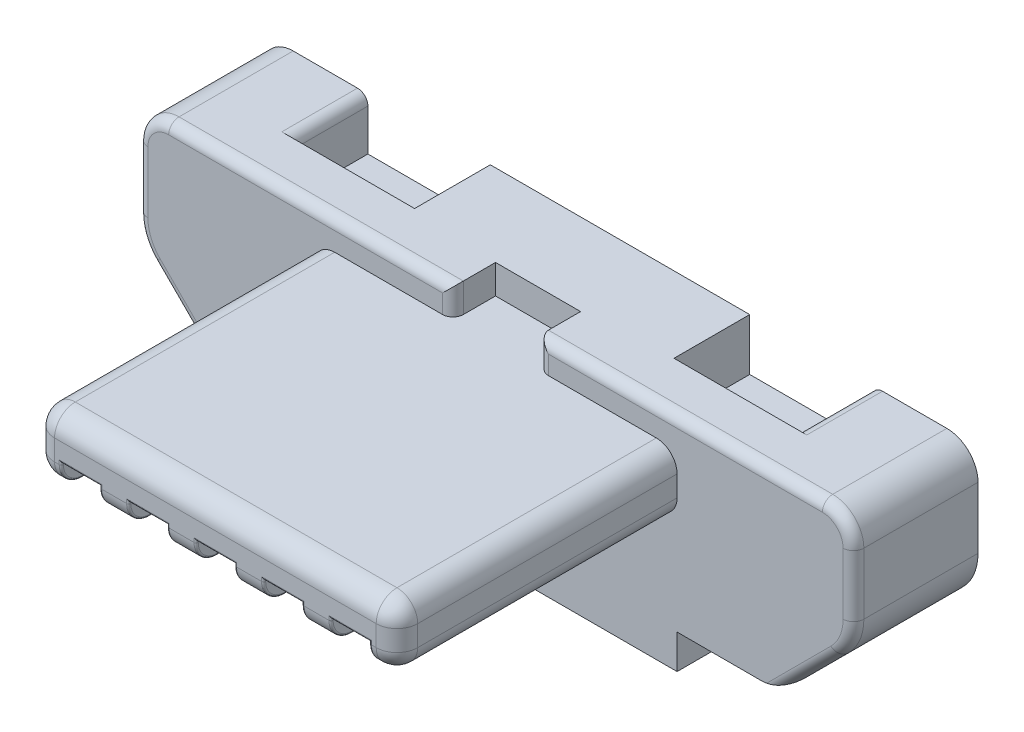
from build123d import *

# Parameters (mm, degrees)
BOSS_EXTRUDE1_DEPTH = 1.2
FILLET1_R           = 0.3
SKETCH4_W           = 1.18
SKETCH4_H           = 2.066052664
CUT_EXTRUDE2_DEPTH  = 0.5
SKETCH5_W           = 3.5
SKETCH5_H           = 0.4
BOSS_EXTRUDE3_DEPTH = 0.28
CUT_EXTRUDE3_DEPTH  = 2.28
CUT_EXTRUDE4_DEPTH  = 2.28
SKETCH2_W           = 0.82
SKETCH2_H           = 0.82
CUT_EXTRUDE1_DEPTH  = 0.41
SKETCH3_W           = 3.5
SKETCH3_H           = 0.6
BOSS_EXTRUDE2_DEPTH = 2.7
FILLET5_R           = 0.2
FILLET7_R           = 0.5
FILLET8_R           = 0.1
FILLET9_R           = 0.1
SKETCH9_W           = 3.5
SKETCH9_H           = 0.6
BOSS_EXTRUDE4_DEPTH = 0.16
SKETCH10_W          = 0.37
SKETCH10_H          = 0.37
CUT_EXTRUDE5_DEPTH  = 2.7
SKETCH13_W          = 0.25
SKETCH13_H          = 0.15
SKETCH11_W          = 0.37
SKETCH11_H          = 0.15
CUT_EXTRUDE6_DEPTH  = 2.8
SKETCH14_W          = 0.25
SKETCH14_H          = 0.15
SKETCH16_W          = 0.25
SKETCH16_H          = 0.15
CUT_EXTRUDE7_DEPTH  = 0.16
SKETCH17_W          = 0.37
SKETCH17_H          = 0.15
BOSS_EXTRUDE5_DEPTH = 2.8
SKETCH18_W          = 0.37
SKETCH18_H          = 0.15
CUT_EXTRUDE8_DEPTH  = 0.15
FILLET10_R          = 0.1
SKETCH19_W          = 0.37
SKETCH19_H          = 0.15
BOSS_EXTRUDE6_DEPTH = 0.15
FILLET11_R          = 0.15
FILLET12_R          = 0.15
FILLET13_R          = 0.15
FILLET14_R          = 0.15
FILLET15_R          = 0.15
FILLET16_R          = 0.01
FILLET17_R          = 0.01
FILLET18_R          = 0.01
FILLET19_R          = 0.01
FILLET20_R          = 0.01
FILLET21_R          = 0.01
FILLET22_R          = 0.01
FILLET23_R          = 0.01
FILLET24_R          = 0.01
FILLET25_R          = 0.01
FILLET26_R          = 0.02


with BuildPart() as part:
    # Sketch1 → Boss-Extrude1 (new body)
    with BuildSketch(Plane.XY):
        Polygon((3.45, 0.925), (-3.45, 0.925), (-3.45, -0.175), (-2.7, -0.925), (2.7, -0.925), (3.45, -0.175), align=None)
    extrude(amount=BOSS_EXTRUDE1_DEPTH)

    # Fillet1
    fillet1_edges = [part.edges().sort_by_distance(p)[0] for p in [
        (-3.45, 0.925, 0.6),
        (3.45, 0.925, 0.6),
    ]]
    fillet(fillet1_edges, radius=FILLET1_R)

    # Sketch4 → Cut-Extrude2 (cut)
    with BuildSketch(Plane(origin=(0, 0.925, 0), x_dir=(1, 0, 0), z_dir=(0, 1, 0))):
        with Locations((-1.84, 0.303026332)):
            Rectangle(SKETCH4_W, SKETCH4_H)
        with Locations((1.84, 0.303026332)):
            Rectangle(SKETCH4_W, SKETCH4_H)
    extrude(amount=-CUT_EXTRUDE2_DEPTH, mode=Mode.SUBTRACT)

    # Sketch5 → Boss-Extrude3 (add)
    with BuildSketch(Plane.XZ.offset(0.925)):
        with Locations((0, 1)):
            Rectangle(SKETCH5_W, SKETCH5_H)
    extrude(amount=BOSS_EXTRUDE3_DEPTH)

    # Sketch7 → Cut-Extrude3 (cut)
    with BuildSketch(Plane.ZY.offset(1.75)):
        Polygon((0, -0.925), (1.2, -0.875), (1.2, -0.925), align=None)
    extrude(amount=CUT_EXTRUDE3_DEPTH, mode=Mode.SUBTRACT)

    # Sketch8 → Cut-Extrude4 (cut)
    with BuildSketch(Plane(origin=(1.75, 0, 0), x_dir=(0, 0, -1), z_dir=(1, 0, 0))):
        Polygon((0, -0.925), (-1.2, -0.875), (-1.2, -0.925), align=None)
    extrude(amount=CUT_EXTRUDE4_DEPTH, mode=Mode.SUBTRACT)

    # Sketch2 → Cut-Extrude1 (cut)
    with BuildSketch(Plane.XY.offset(1.2)):
        with Locations((0, 1.055)):
            Rectangle(SKETCH2_W, SKETCH2_H)
    extrude(amount=-CUT_EXTRUDE1_DEPTH, mode=Mode.SUBTRACT)

    # Sketch3 → Boss-Extrude2 (add)
    with BuildSketch(Plane.XY.offset(1.2)):
        with Locations((0, 0.345)):
            Rectangle(SKETCH3_W, SKETCH3_H)
    extrude(amount=BOSS_EXTRUDE2_DEPTH)

    # Fillet5
    fillet5_edges = [part.edges().sort_by_distance(p)[0] for p in [
        (0, 0.045, 3.9),
        (-1.75, 0.345, 3.9),
        (0, 0.645, 3.9),
        (1.75, 0.345, 3.9),
        (-1.75, 0.045, 2.55),
        (-1.75, 0.645, 2.55),
        (1.75, 0.045, 2.55),
        (1.75, 0.645, 2.55),
    ]]
    fillet(fillet5_edges, radius=FILLET5_R)

    # Fillet7
    fillet7_edges = [part.edges().sort_by_distance(p)[0] for p in [
        (2.725, -0.9, 0.6),
        (3.45, -0.175, 0.6),
        (-3.45, -0.175, 0.6),
        (-2.725, -0.9, 0.6),
    ]]
    fillet(fillet7_edges, radius=FILLET7_R)

    # Fillet8
    # the kernel refuses this fillet: 0.1 mm, written as the material it takes off along each edge
    with BuildSketch(Plane(origin=(-3.45, 0.625, 1.2), x_dir=(1, 0, 0), z_dir=(0, -1, 0)), Plane(origin=(3.45, 0.032106781, 1.2), x_dir=(-1, 0, 0), z_dir=(0, 1, 0))) as fillet8_piece_1:
        with BuildLine():
            CenterArc((FILLET8_R, -FILLET8_R), FILLET8_R, 90, 90)
            Line((0, -FILLET8_R), (-FILLET8_R * 0.02, -FILLET8_R))
            Line((-FILLET8_R * 0.02, -FILLET8_R), (-FILLET8_R * 0.02, FILLET8_R * 0.02))
            Line((-FILLET8_R * 0.02, FILLET8_R * 0.02), (FILLET8_R, FILLET8_R * 0.02))
            Line((FILLET8_R, FILLET8_R * 0.02), (FILLET8_R, 0))
        make_face()
    extrude(amount=0.592893219, mode=Mode.SUBTRACT)
    with BuildSketch(Plane(origin=(3.15, 0.625, 1.2), x_dir=(0, 1, 0), z_dir=(-1, 0, 0))) as fillet8_piece_2:
        with BuildLine():
            CenterArc((0.3 - FILLET8_R, FILLET8_R), FILLET8_R, 270, 90)
            Line((0.3, FILLET8_R), (0.3 + FILLET8_R * 0.02, FILLET8_R))
            Line((0.3 + FILLET8_R * 0.02, FILLET8_R), (0.3 + FILLET8_R * 0.02, -FILLET8_R * 0.02))
            Line((0.3 + FILLET8_R * 0.02, -FILLET8_R * 0.02), (0.3 - FILLET8_R, -FILLET8_R * 0.02))
            Line((0.3 - FILLET8_R, -FILLET8_R * 0.02), (0.3 - FILLET8_R, 0))
        make_face()
    revolve(axis=Axis((3.15, 0.625, 1.2), (0, 0, -1)), revolution_arc=90, mode=Mode.SUBTRACT)
    with BuildSketch(Plane(origin=(-3.15, 0.625, 1.2), x_dir=(0, 1, 0), z_dir=(1, 0, 0))) as fillet8_piece_3:
        with BuildLine():
            CenterArc((0.3 - FILLET8_R, -FILLET8_R), FILLET8_R, 0, 90)
            Line((0.3, -FILLET8_R), (0.3 + FILLET8_R * 0.02, -FILLET8_R))
            Line((0.3 + FILLET8_R * 0.02, -FILLET8_R), (0.3 + FILLET8_R * 0.02, FILLET8_R * 0.02))
            Line((0.3 + FILLET8_R * 0.02, FILLET8_R * 0.02), (0.3 - FILLET8_R, FILLET8_R * 0.02))
            Line((0.3 - FILLET8_R, FILLET8_R * 0.02), (0.3 - FILLET8_R, 0))
        make_face()
    revolve(axis=Axis((-3.15, 0.625, 1.2), (0, 0, 1)), revolution_arc=90, mode=Mode.SUBTRACT)
    with BuildSketch(Plane(origin=(0.41, 1.525, 1.2), x_dir=(1, 0, 0), z_dir=(0, -1, 0)), Plane(origin=(-0.41, 0.645, 1.2), x_dir=(-1, 0, 0), z_dir=(0, 1, 0))) as fillet8_piece_4:
        with BuildLine():
            CenterArc((FILLET8_R, -FILLET8_R), FILLET8_R, 90, 90)
            Line((0, -FILLET8_R), (-FILLET8_R * 0.02, -FILLET8_R))
            Line((-FILLET8_R * 0.02, -FILLET8_R), (-FILLET8_R * 0.02, FILLET8_R * 0.02))
            Line((-FILLET8_R * 0.02, FILLET8_R * 0.02), (FILLET8_R, FILLET8_R * 0.02))
            Line((FILLET8_R, FILLET8_R * 0.02), (FILLET8_R, 0))
        make_face()
    extrude(amount=0.88, mode=Mode.SUBTRACT)
    with BuildSketch(Plane(origin=(0.19, 0.925, 1.2), x_dir=(0, -1, 0), z_dir=(-1, 0, 0)), Plane(origin=(3.15, 0.925, 1.2), x_dir=(0, -1, 0), z_dir=(-1, 0, 0))) as fillet8_piece_5:
        with BuildLine():
            CenterArc((FILLET8_R, -FILLET8_R), FILLET8_R, 90, 90)
            Line((0, -FILLET8_R), (-FILLET8_R * 0.02, -FILLET8_R))
            Line((-FILLET8_R * 0.02, -FILLET8_R), (-FILLET8_R * 0.02, FILLET8_R * 0.02))
            Line((-FILLET8_R * 0.02, FILLET8_R * 0.02), (FILLET8_R, FILLET8_R * 0.02))
            Line((FILLET8_R, FILLET8_R * 0.02), (FILLET8_R, 0))
        make_face()
    extrude(amount=3.34, mode=Mode.SUBTRACT)
    with BuildSketch(Plane(origin=(2.47261638, -1.15238362, 1.2), x_dir=(-0.7071067811865477, 0.7071067811865474, 0), z_dir=(0.7071067811865475, 0.7071067811865477, 0)), Plane(origin=(-3.303553391, -0.321446609, 1.2), x_dir=(0.7071067811865476, 0.7071067811865476, 0), z_dir=(0.7071067811865477, -0.7071067811865476, 0))) as fillet8_piece_6:
        with BuildLine():
            CenterArc((FILLET8_R, -FILLET8_R), FILLET8_R, 90, 90)
            Line((0, -FILLET8_R), (-FILLET8_R * 0.02, -FILLET8_R))
            Line((-FILLET8_R * 0.02, -FILLET8_R), (-FILLET8_R * 0.02, FILLET8_R * 0.02))
            Line((-FILLET8_R * 0.02, FILLET8_R * 0.02), (FILLET8_R, FILLET8_R * 0.02))
            Line((FILLET8_R, FILLET8_R * 0.02), (FILLET8_R, 0))
        make_face()
    extrude(amount=1.175122389, mode=Mode.SUBTRACT)
    with BuildSketch(Plane(origin=(2.95, 0.032106781, 1.2), x_dir=(0.7071067811865479, -0.7071067811865474, 0), z_dir=(-0.7071067811865474, -0.7071067811865479, 0))) as fillet8_piece_7:
        with BuildLine():
            CenterArc((0.5 - FILLET8_R, -FILLET8_R), FILLET8_R, 0, 90)
            Line((0.5, -FILLET8_R), (0.5 + FILLET8_R * 0.02, -FILLET8_R))
            Line((0.5 + FILLET8_R * 0.02, -FILLET8_R), (0.5 + FILLET8_R * 0.02, FILLET8_R * 0.02))
            Line((0.5 + FILLET8_R * 0.02, FILLET8_R * 0.02), (0.5 - FILLET8_R, FILLET8_R * 0.02))
            Line((0.5 - FILLET8_R, FILLET8_R * 0.02), (0.5 - FILLET8_R, 0))
        make_face()
    revolve(axis=Axis((2.95, 0.032106781, 1.2), (0, 0, 1)), revolution_arc=45, mode=Mode.SUBTRACT)
    with BuildSketch(Plane(origin=(-2.95, 0.032106781, 1.2), x_dir=(-1, 0, 0), z_dir=(0, 1, 0))) as fillet8_piece_8:
        with BuildLine():
            CenterArc((0.5 - FILLET8_R, -FILLET8_R), FILLET8_R, 0, 90)
            Line((0.5, -FILLET8_R), (0.5 + FILLET8_R * 0.02, -FILLET8_R))
            Line((0.5 + FILLET8_R * 0.02, -FILLET8_R), (0.5 + FILLET8_R * 0.02, FILLET8_R * 0.02))
            Line((0.5 + FILLET8_R * 0.02, FILLET8_R * 0.02), (0.5 - FILLET8_R, FILLET8_R * 0.02))
            Line((0.5 - FILLET8_R, FILLET8_R * 0.02), (0.5 - FILLET8_R, 0))
        make_face()
    revolve(axis=Axis((-2.95, 0.032106781, 1.2), (0, 0, 1)), revolution_arc=45, mode=Mode.SUBTRACT)

    # Fillet9
    fillet9_edges = [part.edges().sort_by_distance(p)[0] for p in [
        (-2.43, 0.925, 0.365),
        (2.43, 0.925, 0.365),
    ]]
    fillet(fillet9_edges, radius=FILLET9_R)

    # Sketch9 → Boss-Extrude4 (add)
    with BuildSketch(Plane.XZ.offset(0.925)):
        with Locations((0, 0.35)):
            Rectangle(SKETCH9_W, SKETCH9_H)
    extrude(amount=BOSS_EXTRUDE4_DEPTH)

    # Sketch10 → Cut-Extrude5 (cut)
    with BuildSketch(Plane.XY.offset(3.9)):
        with Locations((-1.3, 0.08)):
            Rectangle(SKETCH10_W, SKETCH10_H)
        with Locations((-0.65, 0.08)):
            Rectangle(SKETCH10_W, SKETCH10_H)
        with Locations((0, 0.08)):
            Rectangle(SKETCH10_W, SKETCH10_H)
        with Locations((0.65, 0.08)):
            Rectangle(SKETCH10_W, SKETCH10_H)
        with Locations((1.3, 0.08)):
            Rectangle(SKETCH10_W, SKETCH10_H)
    extrude(amount=-CUT_EXTRUDE5_DEPTH, mode=Mode.SUBTRACT)

    # Cut-Sweep2: sweep along a path in Sketch12
    with BuildLine(Plane(origin=(0, 0, 0), x_dir=(0, 0, -1), z_dir=(1, 0, 0))) as cut_sweep2_path:
        Line((-3.7, 0.315), (-0.55, 0.315))
        ThreePointArc((-0.55, 0.315), (-0.408578644, 0.256421356), (-0.35, 0.115))
        Line((-0.35, 0.115), (-0.35, -1.085))
    # Sketch13 → Cut-Sweep2 (sweep, cut)
    with BuildSketch(Plane.XY.offset(3.7)):
        with Locations((-1.3, 0.24)):
            Rectangle(SKETCH13_W, SKETCH13_H)
        with Locations((-0.65, 0.24)):
            Rectangle(SKETCH13_W, SKETCH13_H)
        with Locations((0, 0.24)):
            Rectangle(SKETCH13_W, SKETCH13_H)
        with Locations((0.65, 0.24)):
            Rectangle(SKETCH13_W, SKETCH13_H)
        with Locations((1.3, 0.24)):
            Rectangle(SKETCH13_W, SKETCH13_H)
    sweep(path=cut_sweep2_path.line, mode=Mode.SUBTRACT)

    # Sketch11 → Cut-Extrude6 (cut)
    with BuildSketch(Plane.XY.offset(3.7)):
        with Locations((-1.3, 0.24)):
            Rectangle(SKETCH11_W, SKETCH11_H)
        with Locations((-0.65, 0.24)):
            Rectangle(SKETCH11_W, SKETCH11_H)
        with Locations((0, 0.24)):
            Rectangle(SKETCH11_W, SKETCH11_H)
        with Locations((0.65, 0.24)):
            Rectangle(SKETCH11_W, SKETCH11_H)
        with Locations((1.3, 0.24)):
            Rectangle(SKETCH11_W, SKETCH11_H)
    extrude(amount=-CUT_EXTRUDE6_DEPTH, mode=Mode.SUBTRACT)

    # Sketch16 → Cut-Extrude7 (cut)
    with BuildSketch(Plane.XZ.offset(1.085)):
        with Locations((-1.3, 0.575)):
            Rectangle(SKETCH16_W, SKETCH16_H)
        with Locations((-0.65, 0.575)):
            Rectangle(SKETCH16_W, SKETCH16_H)
        with Locations((0, 0.575)):
            Rectangle(SKETCH16_W, SKETCH16_H)
        with Locations((0.65, 0.575)):
            Rectangle(SKETCH16_W, SKETCH16_H)
        with Locations((1.3, 0.575)):
            Rectangle(SKETCH16_W, SKETCH16_H)
    extrude(amount=-CUT_EXTRUDE7_DEPTH, mode=Mode.SUBTRACT)

    # Sketch18 → Cut-Extrude8 (cut)
    with BuildSketch(Plane.XZ.offset(-0.315)):
        with Locations((1.3, 3.625)):
            Rectangle(SKETCH18_W, SKETCH18_H)
        with Locations((0.65, 3.625)):
            Rectangle(SKETCH18_W, SKETCH18_H)
        with Locations((0, 3.625)):
            Rectangle(SKETCH18_W, SKETCH18_H)
        with Locations((-0.65, 3.625)):
            Rectangle(SKETCH18_W, SKETCH18_H)
        with Locations((-1.3, 3.625)):
            Rectangle(SKETCH18_W, SKETCH18_H)
    extrude(amount=-CUT_EXTRUDE8_DEPTH, mode=Mode.SUBTRACT)

    # Fillet10
    fillet10_edges = [part.edges().sort_by_distance(p)[0] for p in [
        (-1.3, -1.085, 0.35),
        (-0.65, -1.085, 0.35),
        (0, -1.085, 0.35),
        (0.65, -1.085, 0.35),
        (1.3, -1.085, 0.35),
        (1.3, 0.315, 3.55),
        (0.65, 0.315, 3.55),
        (0, 0.315, 3.55),
        (-0.65, 0.315, 3.55),
        (-1.3, 0.315, 3.55),
    ]]
    fillet(fillet10_edges, radius=FILLET10_R)

    # Fillet26
    fillet26_edges = [part.edges().sort_by_distance(p)[0] for p in [
        (-1.115, 0.103578644, 3.841421356),
        (-1.485, 0.103578644, 3.841421356),
        (-1.485, 0.045, 2.45),
        (-1.115, 0.045, 2.45),
        (-1.485, 0.255, 3.9),
        (-1.115, 0.255, 3.9),
        (-1.3, 0.265, 3.9),
        (-0.465, 0.103578644, 3.841421356),
        (-0.835, 0.103578644, 3.841421356),
        (-0.835, 0.045, 2.45),
        (-0.465, 0.045, 2.45),
        (-0.835, 0.255, 3.9),
        (-0.465, 0.255, 3.9),
        (-0.65, 0.265, 3.9),
        (0.185, 0.103578644, 3.841421356),
        (-0.185, 0.103578644, 3.841421356),
        (-0.185, 0.045, 2.45),
        (0.185, 0.045, 2.45),
        (-0.185, 0.255, 3.9),
        (0.185, 0.255, 3.9),
        (0, 0.265, 3.9),
        (0.835, 0.103578644, 3.841421356),
        (0.465, 0.103578644, 3.841421356),
        (0.465, 0.045, 2.45),
        (0.835, 0.045, 2.45),
        (0.465, 0.255, 3.9),
        (0.835, 0.255, 3.9),
        (0.65, 0.265, 3.9),
        (1.485, 0.103578644, 3.841421356),
        (1.115, 0.103578644, 3.841421356),
        (1.115, 0.045, 2.45),
        (1.485, 0.045, 2.45),
        (1.115, 0.255, 3.9),
        (1.485, 0.255, 3.9),
        (1.3, 0.265, 3.9),
    ]]
    fillet(fillet26_edges, radius=FILLET26_R)


with BuildPart() as body_2:
    # Sweep3: sweep along a path in Sketch15
    with BuildLine(Plane(origin=(0, 0, 0), x_dir=(0, 0, -1), z_dir=(1, 0, 0))) as sweep3_path:
        Line((0.3, -1.085), (-0.3, -1.085))
        ThreePointArc((-0.3, -1.085), (-0.335355339, -1.070355339), (-0.35, -1.035))
        Line((-0.35, -1.035), (-0.35, 0.115))
        ThreePointArc((-0.35, 0.115), (-0.408578644, 0.256421356), (-0.55, 0.315))
        Line((-0.55, 0.315), (-3.7, 0.315))
    # Sketch14 → Sweep3 (sweep)
    with BuildSketch(Plane.XY.offset(3.7)):
        with Locations((-1.3, 0.24)):
            Rectangle(SKETCH14_W, SKETCH14_H)
        with Locations((1.3, 0.24)):
            Rectangle(SKETCH14_W, SKETCH14_H)
        with Locations((0.65, 0.24)):
            Rectangle(SKETCH14_W, SKETCH14_H)
        with Locations((0, 0.24)):
            Rectangle(SKETCH14_W, SKETCH14_H)
        with Locations((-0.65, 0.24)):
            Rectangle(SKETCH14_W, SKETCH14_H)
    sweep(path=sweep3_path.line)

    # Sketch17 → Boss-Extrude5 (add)
    with BuildSketch(Plane.XY.offset(3.7)):
        with Locations((-0.65, 0.24)):
            Rectangle(SKETCH17_W, SKETCH17_H)
        with Locations((-1.3, 0.24)):
            Rectangle(SKETCH17_W, SKETCH17_H)
        with Locations((1.3, 0.24)):
            Rectangle(SKETCH17_W, SKETCH17_H)
        with Locations((0.65, 0.24)):
            Rectangle(SKETCH17_W, SKETCH17_H)
        with Locations((0, 0.24)):
            Rectangle(SKETCH17_W, SKETCH17_H)
    extrude(amount=-BOSS_EXTRUDE5_DEPTH)

    # Sketch19 → Boss-Extrude6 (add)
    with BuildSketch(Plane(origin=(0, 0.315, 0), x_dir=(1, 0, 0), z_dir=(0, 1, 0))):
        with Locations((-1.3, -3.625)):
            Rectangle(SKETCH19_W, SKETCH19_H)
        with Locations((-0.65, -3.625)):
            Rectangle(SKETCH19_W, SKETCH19_H)
        with Locations((0, -3.625)):
            Rectangle(SKETCH19_W, SKETCH19_H)
        with Locations((0.65, -3.625)):
            Rectangle(SKETCH19_W, SKETCH19_H)
        with Locations((1.3, -3.625)):
            Rectangle(SKETCH19_W, SKETCH19_H)
    extrude(amount=BOSS_EXTRUDE6_DEPTH)

    # Fillet11
    fillet11_edges = [body_2.edges().sort_by_distance(p)[0] for p in [
        (1.3, 0.165, 3.7),
    ]]
    fillet(fillet11_edges, radius=FILLET11_R)

    # Fillet12
    fillet12_edges = [body_2.edges().sort_by_distance(p)[0] for p in [
        (0.65, 0.165, 3.7),
    ]]
    fillet(fillet12_edges, radius=FILLET12_R)

    # Fillet13
    fillet13_edges = [body_2.edges().sort_by_distance(p)[0] for p in [
        (0, 0.165, 3.7),
    ]]
    fillet(fillet13_edges, radius=FILLET13_R)

    # Fillet14
    fillet14_edges = [body_2.edges().sort_by_distance(p)[0] for p in [
        (-0.65, 0.165, 3.7),
    ]]
    fillet(fillet14_edges, radius=FILLET14_R)

    # Fillet15
    fillet15_edges = [body_2.edges().sort_by_distance(p)[0] for p in [
        (-1.3, 0.165, 3.7),
    ]]
    fillet(fillet15_edges, radius=FILLET15_R)

    # Fillet16
    fillet16_edges = [body_2.edges().sort_by_distance(p)[0] for p in [
        (-1.425, 0.150355339, 0.514644661),
        (-1.175, 0.150355339, 0.514644661),
        (-1.425, -0.46, 0.5),
        (-1.175, -0.46, 0.5),
        (-1.425, -1.176421356, 0.441421356),
        (-1.175, -1.176421356, 0.441421356),
        (-1.3, -1.235, -0.3),
        (-1.425, -1.235, 0),
        (-1.175, -1.235, 0),
        (-1.175, 0.165, 0.725),
        (-1.425, 0.165, 0.725),
    ]]
    fillet(fillet16_edges, radius=FILLET16_R)

    # Fillet17
    fillet17_edges = [body_2.edges().sort_by_distance(p)[0] for p in [
        (-0.775, 0.150355339, 0.514644661),
        (-0.525, 0.150355339, 0.514644661),
        (-0.775, -0.46, 0.5),
        (-0.525, -0.46, 0.5),
        (-0.775, -1.176421356, 0.441421356),
        (-0.525, -1.176421356, 0.441421356),
        (-0.65, -1.235, -0.3),
        (-0.775, -1.235, 0),
        (-0.525, -1.235, 0),
        (-0.525, 0.165, 0.725),
        (-0.775, 0.165, 0.725),
    ]]
    fillet(fillet17_edges, radius=FILLET17_R)

    # Fillet18
    fillet18_edges = [body_2.edges().sort_by_distance(p)[0] for p in [
        (-0.125, 0.150355339, 0.514644661),
        (0.125, 0.150355339, 0.514644661),
        (-0.125, -0.46, 0.5),
        (0.125, -0.46, 0.5),
        (-0.125, -1.176421356, 0.441421356),
        (0.125, -1.176421356, 0.441421356),
        (0, -1.235, -0.3),
        (-0.125, -1.235, 0),
        (0.125, -1.235, 0),
        (0.125, 0.165, 0.725),
        (-0.125, 0.165, 0.725),
    ]]
    fillet(fillet18_edges, radius=FILLET18_R)

    # Fillet19
    fillet19_edges = [body_2.edges().sort_by_distance(p)[0] for p in [
        (0.525, 0.150355339, 0.514644661),
        (0.775, 0.150355339, 0.514644661),
        (0.525, -0.46, 0.5),
        (0.775, -0.46, 0.5),
        (0.525, -1.176421356, 0.441421356),
        (0.775, -1.176421356, 0.441421356),
        (0.65, -1.235, -0.3),
        (0.525, -1.235, 0),
        (0.775, -1.235, 0),
        (0.775, 0.165, 0.725),
        (0.525, 0.165, 0.725),
    ]]
    fillet(fillet19_edges, radius=FILLET19_R)

    # Fillet20
    fillet20_edges = [body_2.edges().sort_by_distance(p)[0] for p in [
        (1.175, 0.150355339, 0.514644661),
        (1.425, 0.150355339, 0.514644661),
        (1.175, -0.46, 0.5),
        (1.425, -0.46, 0.5),
        (1.175, -1.176421356, 0.441421356),
        (1.425, -1.176421356, 0.441421356),
        (1.3, -1.235, -0.3),
        (1.175, -1.235, 0),
        (1.425, -1.235, 0),
        (1.425, 0.165, 0.725),
        (1.175, 0.165, 0.725),
    ]]
    fillet(fillet20_edges, radius=FILLET20_R)

    # Fillet21
    fillet21_edges = [body_2.edges().sort_by_distance(p)[0] for p in [
        (1.425, 0.256421356, 0.408578644),
        (1.175, 0.256421356, 0.408578644),
        (1.425, -0.46, 0.35),
        (1.175, -0.46, 0.35),
        (1.425, -1.070355339, 0.335355339),
        (1.175, -1.070355339, 0.335355339),
        (1.3, -1.085, -0.3),
        (1.425, -1.085, 0),
        (1.175, -1.085, 0),
        (1.175, 0.315, 0.725),
        (1.425, 0.315, 0.725),
    ]]
    fillet(fillet21_edges, radius=FILLET21_R)

    # Fillet22
    fillet22_edges = [body_2.edges().sort_by_distance(p)[0] for p in [
        (0.775, 0.256421356, 0.408578644),
        (0.525, 0.256421356, 0.408578644),
        (0.775, -0.46, 0.35),
        (0.525, -0.46, 0.35),
        (0.775, -1.070355339, 0.335355339),
        (0.525, -1.070355339, 0.335355339),
        (0.65, -1.085, -0.3),
        (0.775, -1.085, 0),
        (0.525, -1.085, 0),
        (0.525, 0.315, 0.725),
        (0.775, 0.315, 0.725),
    ]]
    fillet(fillet22_edges, radius=FILLET22_R)

    # Fillet23
    fillet23_edges = [body_2.edges().sort_by_distance(p)[0] for p in [
        (0.125, 0.256421356, 0.408578644),
        (-0.125, 0.256421356, 0.408578644),
        (0.125, -0.46, 0.35),
        (-0.125, -0.46, 0.35),
        (0.125, -1.070355339, 0.335355339),
        (-0.125, -1.070355339, 0.335355339),
        (0, -1.085, -0.3),
        (0.125, -1.085, 0),
        (-0.125, -1.085, 0),
        (-0.125, 0.315, 0.725),
        (0.125, 0.315, 0.725),
    ]]
    fillet(fillet23_edges, radius=FILLET23_R)

    # Fillet24
    fillet24_edges = [body_2.edges().sort_by_distance(p)[0] for p in [
        (-0.525, 0.256421356, 0.408578644),
        (-0.775, 0.256421356, 0.408578644),
        (-0.525, -0.46, 0.35),
        (-0.775, -0.46, 0.35),
        (-0.525, -1.070355339, 0.335355339),
        (-0.775, -1.070355339, 0.335355339),
        (-0.65, -1.085, -0.3),
        (-0.525, -1.085, 0),
        (-0.775, -1.085, 0),
        (-0.775, 0.315, 0.725),
        (-0.525, 0.315, 0.725),
    ]]
    fillet(fillet24_edges, radius=FILLET24_R)

    # Fillet25
    fillet25_edges = [body_2.edges().sort_by_distance(p)[0] for p in [
        (-1.175, 0.256421356, 0.408578644),
        (-1.425, 0.256421356, 0.408578644),
        (-1.175, -0.46, 0.35),
        (-1.425, -0.46, 0.35),
        (-1.175, -1.070355339, 0.335355339),
        (-1.425, -1.070355339, 0.335355339),
        (-1.3, -1.085, -0.3),
        (-1.175, -1.085, 0),
        (-1.425, -1.085, 0),
        (-1.425, 0.315, 0.725),
        (-1.175, 0.315, 0.725),
    ]]
    fillet(fillet25_edges, radius=FILLET25_R)


solid = Compound([part.part, body_2.part])
